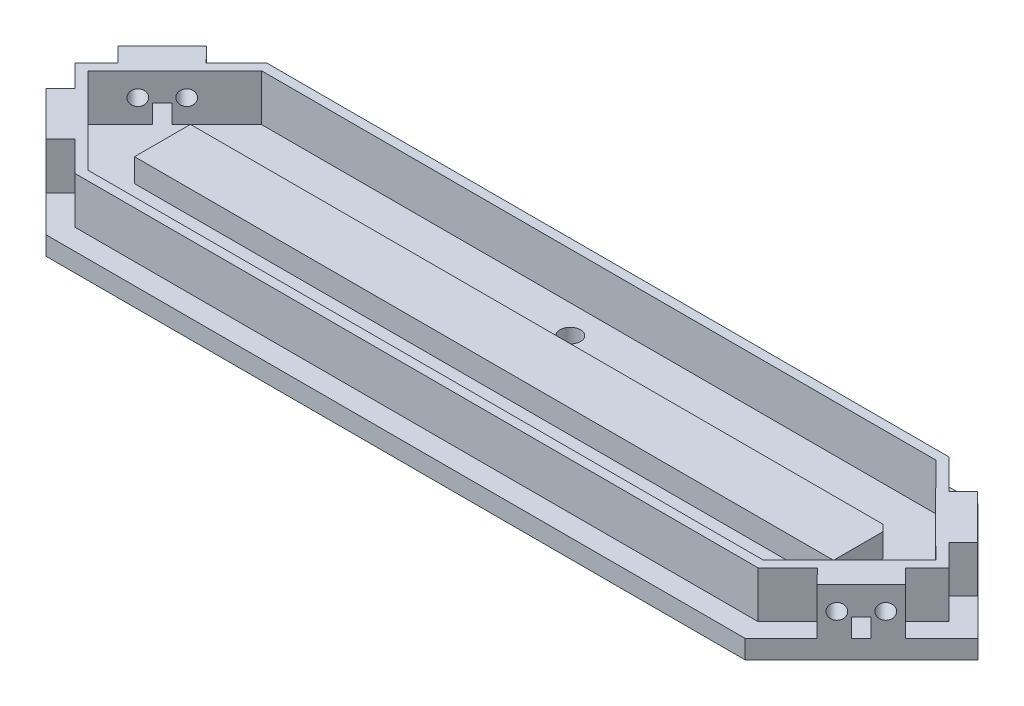
from build123d import *

# Parameters (mm, degrees)
SKIZZE1_W                       = 200
SKIZZE1_H                       = 50
AUFSATZ_LINEAR_AUSTRAGEN1_DEPTH = 4
FASE1_SIZE                      = 25
AUFSATZ_LINEAR_AUSTRAGEN2_DEPTH = 10
SKIZZE3_W                       = 15.35533906
SKIZZE3_H                       = 10
SCHNITT_LINEAR_AUSTRAGEN1_DEPTH = 10
SKIZZE4_W                       = 15.35533906
SKIZZE4_H                       = 10
SCHNITT_LINEAR_AUSTRAGEN2_DEPTH = 10
SKIZZE5_W                       = 150
SKIZZE5_H                       = 12
AUFSATZ_LINEAR_AUSTRAGEN3_DEPTH = 5
AUFSATZ_LINEAR_AUSTRAGEN4_DEPTH = 10
AUFSATZ_LINEAR_AUSTRAGEN5_DEPTH = 10
SKIZZE11_R                      = 1.65
SKIZZE11_W                      = 2.95533906
SKIZZE11_H                      = 4
SCHNITT_LINEAR_AUSTRAGEN7_DEPTH = 10
SKIZZE12_R                      = 2.2
SCHNITT_LINEAR_AUSTRAGEN8_DEPTH = 10
AUFSATZ_LINEAR_AUSTRAGEN6_DEPTH = 10
SKIZZE8_R                       = 1.65
SKIZZE8_W                       = 3.016289267
SKIZZE8_H                       = 4
SCHNITT_LINEAR_AUSTRAGEN9_DEPTH = 10
KREISMUSTER1_START              = 56.301499416
KREISMUSTER1_OUTLINE_R          = 1.65
KREISMUSTER1_DEPTH              = 0.969560509
KREISMUSTER1_START_2            = 64.310678119
KREISMUSTER1_2_OUTLINE_W        = 0.949011964
KREISMUSTER1_2_OUTLINE_H        = 10
KREISMUSTER1_2_OUTLINE_R        = 1.65
KREISMUSTER1_2_OUTLINE_W_2      = 1.050988037
KREISMUSTER1_2_OUTLINE_W_3      = 2.955339059
KREISMUSTER1_2_OUTLINE_H_2      = 4
KREISMUSTER1_2_DEPTH            = 1.990821297
KREISMUSTER1_START_3            = 66.301499416
KREISMUSTER1_3_OUTLINE_R        = 1.65
KREISMUSTER1_3_OUTLINE_W        = 2.955339059
KREISMUSTER1_3_OUTLINE_H        = 4
KREISMUSTER1_3_DEPTH            = 0.009178703
KREISMUSTER1_START_4            = 64.242319383
KREISMUSTER1_4_OUTLINE_R        = 1.65
KREISMUSTER1_4_DEPTH            = 6.4
AUFSATZ_LINEAR_AUSTRAGEN7_DEPTH = 10
KREISMUSTER2_COUNT              = 2


# Read off the part's stored shape, not the designer's step: Kreismuster1
with BuildPart() as part:
    # Skizze1 → Aufsatz-Linear austragen1 (new body)
    with BuildSketch(Plane(origin=(0, 0, 0), x_dir=(1, 0, 0), z_dir=(0, 1, 0))):
        Rectangle(SKIZZE1_W, SKIZZE1_H)
    extrude(amount=AUFSATZ_LINEAR_AUSTRAGEN1_DEPTH)

    # Fase1
    fase1_edges = [part.edges().sort_by_distance(p)[0] for p in [
        (-100, 2, -25),
        (-100, 2, 25),
        (100, 2, -25),
        (100, 2, 25),
    ]]
    chamfer(fase1_edges, length=FASE1_SIZE - 0.0001)  # a hair under: the kernel refuses the full size

    # Skizze2 → Aufsatz-Linear austragen2 (add)
    with BuildSketch(Plane(origin=(0, 4, 0), x_dir=(1, 0, 0), z_dir=(0, 1, 0))):
        Polygon((-73.177460326, 20.6), (-93.777460326, 0), (-73.277460326, -20.5), (73.277460326, -20.5), (93.777460326, 0), (73.177460326, 20.6), align=None)
        Polygon((90.949033201, 0), (72.349033201, 18.6), (-72.349033201, 18.6), (-90.949033201, 0), (-72.449033201, -18.5), (72.449033201, -18.5), align=None, mode=Mode.SUBTRACT)
    extrude(amount=AUFSATZ_LINEAR_AUSTRAGEN2_DEPTH)

    # Skizze3 → Schnitt-Linear austragen1 (cut)
    with BuildSketch(Plane(origin=(-46.888730163, 0, 46.888730163), x_dir=(0.7071067811865476, 0, 0.7071067811865476), z_dir=(-0.7071067811865476, 0, 0.7071067811865476))):
        with Locations((-53.033008589, 9)):
            Rectangle(SKIZZE3_W, SKIZZE3_H)
    extrude(amount=-SCHNITT_LINEAR_AUSTRAGEN1_DEPTH, mode=Mode.SUBTRACT)

    # Skizze4 → Schnitt-Linear austragen2 (cut)
    with BuildSketch(Plane(origin=(46.888730163, 0, 46.888730163), x_dir=(0.7071067811865475, 0, -0.7071067811865477), z_dir=(0.7071067811865477, 0, 0.7071067811865475))):
        with Locations((53.033008589, 9)):
            Rectangle(SKIZZE4_W, SKIZZE4_H)
    extrude(amount=-SCHNITT_LINEAR_AUSTRAGEN2_DEPTH, mode=Mode.SUBTRACT)

    # Skizze5 → Aufsatz-Linear austragen3 (add)
    with BuildSketch(Plane(origin=(0, 4, 0), x_dir=(1, 0, 0), z_dir=(0, 1, 0))):
        with Locations((-0.006490323, 0)):
            Rectangle(SKIZZE5_W, SKIZZE5_H)
    extrude(amount=AUFSATZ_LINEAR_AUSTRAGEN3_DEPTH)

    # Skizze6 → Aufsatz-Linear austragen4 (add)
    with BuildSketch(Plane(origin=(0, 4, 0), x_dir=(1, 0, 0), z_dir=(0, 1, 0))):
        Polygon((87.696342007, -3.252691193), (78.252691193, -12.696342007), (82.735076288, -17.264923712), (92.221825407, -7.778174593), align=None)
    aufsatz_linear_austragen4 = extrude(amount=AUFSATZ_LINEAR_AUSTRAGEN4_DEPTH)

    # Skizze10 → Aufsatz-Linear austragen5 (add)
    with BuildSketch(Plane(origin=(0, 4, 0), x_dir=(1, 0, 0), z_dir=(0, 1, 0))):
        Polygon((-87.696342007, -3.252691193), (-78.252691193, -12.696342007), (-82.778174593, -17.221825407), (-92.221825407, -7.778174593), align=None)
    extrude(amount=AUFSATZ_LINEAR_AUSTRAGEN5_DEPTH)

    # Skizze11 → Schnitt-Linear austragen7 (cut)
    with BuildSketch(Plane(origin=(-50, 0, 50), x_dir=(0.7071067811865465, 0, 0.7071067811865488), z_dir=(-0.7071067811865488, 0, 0.7071067811865465))):
        with Locations((-56.710678119, 9)):
            Circle(SKIZZE11_R)
        with Locations((-49.355339059, 9)):
            Circle(SKIZZE11_R)
        with Locations((-53.033008589, 6)):
            Rectangle(SKIZZE11_W, SKIZZE11_H)
    extrude(amount=-SCHNITT_LINEAR_AUSTRAGEN7_DEPTH, mode=Mode.SUBTRACT)

    # Skizze12 → Schnitt-Linear austragen8 (cut)
    with BuildSketch(Plane(origin=(0, 4, 0), x_dir=(1, 0, 0), z_dir=(0, 1, 0))):
        with Locations(Location((0, 12.5, 0), (0, 0, 270))):
            Circle(SKIZZE12_R)
        with Locations(Location((0, -12.5, 0), (0, 0, 270))):
            Circle(SKIZZE12_R)
    extrude(amount=-SCHNITT_LINEAR_AUSTRAGEN8_DEPTH, mode=Mode.SUBTRACT)

    # Skizze13 → Aufsatz-Linear austragen6 (add)
    with BuildSketch(Plane(origin=(0, 4, 0), x_dir=(1, 0, 0), z_dir=(0, 1, 0))):
        Polygon((89.817662351, -3.959797975), (88.403448789, -2.545584412), (87.69285367, -3.256179531), (89.107067232, -4.670393094), align=None)
        Polygon((-89.817662351, -3.959797975), (-88.403448789, -2.545584412), (-87.689553601, -3.2594796), (-89.103767163, -4.673693162), align=None)
        Polygon((78.959797975, -14.817662351), (77.545584412, -13.403448789), (78.257117259, -12.691915942), (79.671330821, -14.106129505), align=None)
        Polygon((-78.959797975, -14.817662351), (-77.545584412, -13.403448789), (-78.262212477, -12.686820723), (-79.67642604, -14.101034286), align=None)
    aufsatz_linear_austragen6 = extrude(amount=AUFSATZ_LINEAR_AUSTRAGEN6_DEPTH)

    # Skizze8 → Schnitt-Linear austragen9 (cut)
    with BuildSketch(Plane(origin=(50, 0, 50), x_dir=(0.7071067811865488, 0, -0.7071067811865465), z_dir=(0.7071067811865465, 0, 0.7071067811865488))):
        with Locations((49.294388852, 9)):
            Circle(SKIZZE8_R)
        with Locations((56.710678119, 9)):
            Circle(SKIZZE8_R)
        with Locations((53.002533486, 6)):
            Rectangle(SKIZZE8_W, SKIZZE8_H)
    schnitt_linear_austragen9 = extrude(amount=-SCHNITT_LINEAR_AUSTRAGEN9_DEPTH, mode=Mode.SUBTRACT)

    # Kreismuster1 outline → Kreismuster1 (cut)
    with BuildSketch(Plane(origin=(0, 0, 0), x_dir=(0.707106781186546, 0, 0.707106781186549), z_dir=(0.707106781186549, 0, -0.707106781186546)).offset(KREISMUSTER1_START)):
        Polygon((46.29517232, -9), (46.29517232, -14), (59.650511379, -14), (59.650511379, -4), (54.450511379, -4), (54.450511379, -8), (51.49517232, -8), (51.49517232, -4), (46.29517232, -4), align=None)
        with BuildLine():
            Line((47.64517232, -9), (50.94517232, -9))
            ThreePointArc((50.94517232, -9), (49.29517232, -10.65), (47.64517232, -9))
        make_face(mode=Mode.SUBTRACT)
        with Locations((56.650511379, -9)):
            Circle(KREISMUSTER1_OUTLINE_R, mode=Mode.SUBTRACT)
    extrude(amount=KREISMUSTER1_DEPTH, mode=Mode.SUBTRACT)

    # Kreismuster1 2 outline → Kreismuster1 2 (cut)
    with BuildSketch(Plane(origin=(0, 0, 0), x_dir=(0.707106781186546, 0, 0.707106781186549), z_dir=(0.707106781186549, 0, -0.707106781186546)).offset(KREISMUSTER1_START_2)):
        with Locations((45.820666338, -9)):
            Rectangle(KREISMUSTER1_2_OUTLINE_W, KREISMUSTER1_2_OUTLINE_H)
        with Locations((56.650511379, -9)):
            Circle(KREISMUSTER1_2_OUTLINE_R)
        with Locations((49.29517232, -9)):
            Circle(KREISMUSTER1_2_OUTLINE_R)
        with Locations((60.176005398, -9)):
            Rectangle(KREISMUSTER1_2_OUTLINE_W_2, KREISMUSTER1_2_OUTLINE_H)
        with Locations((52.972841849, -6)):
            Rectangle(KREISMUSTER1_2_OUTLINE_W_3, KREISMUSTER1_2_OUTLINE_H_2)
    extrude(amount=KREISMUSTER1_2_DEPTH, mode=Mode.SUBTRACT)

    # Kreismuster1 3 outline → Kreismuster1 3 (cut)
    with BuildSketch(Plane(origin=(0, 0, 0), x_dir=(0.707106781186546, 0, 0.707106781186549), z_dir=(0.707106781186549, 0, -0.707106781186546)).offset(KREISMUSTER1_START_3)):
        with Locations((56.650511379, -9)):
            Circle(KREISMUSTER1_3_OUTLINE_R)
        with Locations((49.29517232, -9)):
            Circle(KREISMUSTER1_3_OUTLINE_R)
        with Locations((52.972841849, -6)):
            Rectangle(KREISMUSTER1_3_OUTLINE_W, KREISMUSTER1_3_OUTLINE_H)
    extrude(amount=KREISMUSTER1_3_DEPTH, mode=Mode.SUBTRACT)

    # Kreismuster1 4 outline → Kreismuster1 4 (add)
    with BuildSketch(Plane(origin=(0, 0, 0), x_dir=(0.707106781186546, 0, 0.707106781186549), z_dir=(0.707106781186549, 0, -0.707106781186546)).offset(KREISMUSTER1_START_4)):
        Polygon((46.29517232, -9), (46.29517232, -14), (59.650511379, -14), (59.650511379, -4), (54.450511379, -4), (54.450511379, -8), (51.49517232, -8), (51.49517232, -4), (46.29517232, -4), align=None)
        with BuildLine():
            ThreePointArc((50.94517232, -9), (49.29517232, -10.65), (47.64517232, -9))
            ThreePointArc((47.64517232, -9), (49.29517232, -7.35), (50.94517232, -9))
        make_face(mode=Mode.SUBTRACT)
        with Locations((56.650511379, -9)):
            Circle(KREISMUSTER1_4_OUTLINE_R, mode=Mode.SUBTRACT)
    extrude(amount=KREISMUSTER1_4_DEPTH)

    # Skizze14 → Aufsatz-Linear austragen7 (add)
    with BuildSketch(Plane(origin=(0, 4, 0), x_dir=(1, 0, 0), z_dir=(0, 1, 0))):
        Polygon((88.396958465, 2.552074735), (89.804681705, 3.959797975), (89.061520937, 4.702958742), (87.653797698, 3.295235503), align=None)
        Polygon((77.539094089, 13.409939112), (78.946817328, 14.817662351), (79.612825848, 14.151653831), (78.205102609, 12.743930592), align=None)
    extrude(amount=AUFSATZ_LINEAR_AUSTRAGEN7_DEPTH)

    # Kreismuster2: Aufsatz-Linear austragen4, Aufsatz-Linear austragen6, Schnitt-Linear austragen9 ×2 about axis
    kreismuster2_axis = Axis((-0.045440618, 0, 0.002896308), (0, 1, 0))
    add([aufsatz_linear_austragen4.rotate(kreismuster2_axis, i * 360 / KREISMUSTER2_COUNT) for i in range(1, KREISMUSTER2_COUNT)])
    add([aufsatz_linear_austragen6.rotate(kreismuster2_axis, i * 360 / KREISMUSTER2_COUNT) for i in range(1, KREISMUSTER2_COUNT)])
    add([schnitt_linear_austragen9.rotate(kreismuster2_axis, i * 360 / KREISMUSTER2_COUNT) for i in range(1, KREISMUSTER2_COUNT)], mode=Mode.SUBTRACT)


solid = part.part
